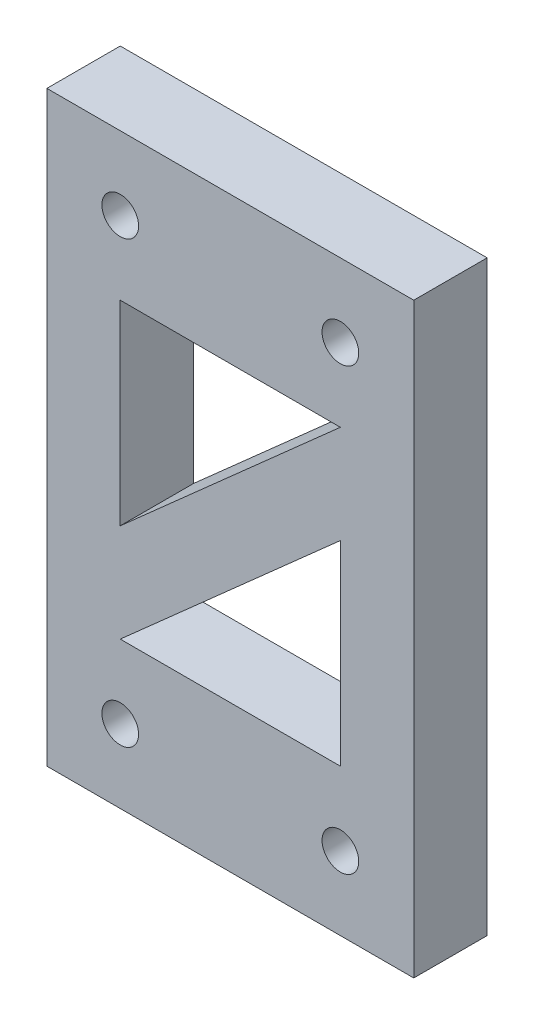
from build123d import *

# Parameters (mm, degrees)
SKETCH1_W          = 50
SKETCH1_H          = 80
BASE_FLANGE1_DEPTH = 10
CUT_EXTRUDE1_REACH = 96.868
SKETCH6_R          = 2.5


# Sheet-metal steps are written as plain solids
with BuildPart() as part:
    # Sketch1 → Base-Flange1 (new body)
    with BuildSketch(Plane.XY):
        with Locations((25, 40)):
            Rectangle(SKETCH1_W, SKETCH1_H)
    extrude(amount=-BASE_FLANGE1_DEPTH)

    # Sketch6 → Cut-Extrude1 (cut, up to next)
    with BuildSketch(Plane.XY, mode=Mode.PRIVATE) as cut_extrude1_sk1:
        with Locations((40, 70)):
            Circle(SKETCH6_R)
    cut_extrude1_tool1 = extrude(cut_extrude1_sk1.sketch, amount=-CUT_EXTRUDE1_REACH, mode=Mode.PRIVATE) & part.part
    # Sketch6 → Cut-Extrude1 (cut, up to next)
    with BuildSketch(Plane.XY, mode=Mode.PRIVATE) as cut_extrude1_sk2:
        with Locations((10, 10)):
            Circle(SKETCH6_R)
    cut_extrude1_tool2 = extrude(cut_extrude1_sk2.sketch, amount=-CUT_EXTRUDE1_REACH, mode=Mode.PRIVATE) & part.part
    # Sketch6 → Cut-Extrude1 (cut, up to next)
    with BuildSketch(Plane.XY, mode=Mode.PRIVATE) as cut_extrude1_sk3:
        with Locations(Location((10, 70, 0), (0, 0, 180))):
            Circle(SKETCH6_R)
    cut_extrude1_tool3 = extrude(cut_extrude1_sk3.sketch, amount=-CUT_EXTRUDE1_REACH, mode=Mode.PRIVATE) & part.part
    # Sketch6 → Cut-Extrude1 (cut, up to next)
    with BuildSketch(Plane.XY, mode=Mode.PRIVATE) as cut_extrude1_sk4:
        with Locations(Location((40, 10, 0), (0, 0, 180))):
            Circle(SKETCH6_R)
    cut_extrude1_tool4 = extrude(cut_extrude1_sk4.sketch, amount=-CUT_EXTRUDE1_REACH, mode=Mode.PRIVATE) & part.part
    # Sketch6 → Cut-Extrude1 (cut, up to next)
    with BuildSketch(Plane.XY, mode=Mode.PRIVATE) as cut_extrude1_sk5:
        Polygon((40, 46.628826929), (40, 20), (10, 20), align=None)
    cut_extrude1_tool5 = extrude(cut_extrude1_sk5.sketch, amount=-CUT_EXTRUDE1_REACH, mode=Mode.PRIVATE) & part.part
    # Sketch6 → Cut-Extrude1 (cut, up to next)
    with BuildSketch(Plane.XY, mode=Mode.PRIVATE) as cut_extrude1_sk6:
        Polygon((40, 60), (10, 33.371173071), (10, 60), align=None)
    cut_extrude1_tool6 = extrude(cut_extrude1_sk6.sketch, amount=-CUT_EXTRUDE1_REACH, mode=Mode.PRIVATE) & part.part
    add(cut_extrude1_tool1.solids().sort_by_distance((40, 70, 0))[0], mode=Mode.SUBTRACT)
    add(cut_extrude1_tool2.solids().sort_by_distance((10, 10, 0))[0], mode=Mode.SUBTRACT)
    add(cut_extrude1_tool3.solids().sort_by_distance((10, 70, 0))[0], mode=Mode.SUBTRACT)
    add(cut_extrude1_tool4.solids().sort_by_distance((40, 10, 0))[0], mode=Mode.SUBTRACT)
    add(cut_extrude1_tool5.solids().sort_by_distance((30, 28.876276, 0))[0], mode=Mode.SUBTRACT)
    add(cut_extrude1_tool6.solids().sort_by_distance((20, 51.123724, 0))[0], mode=Mode.SUBTRACT)


solid = part.part
